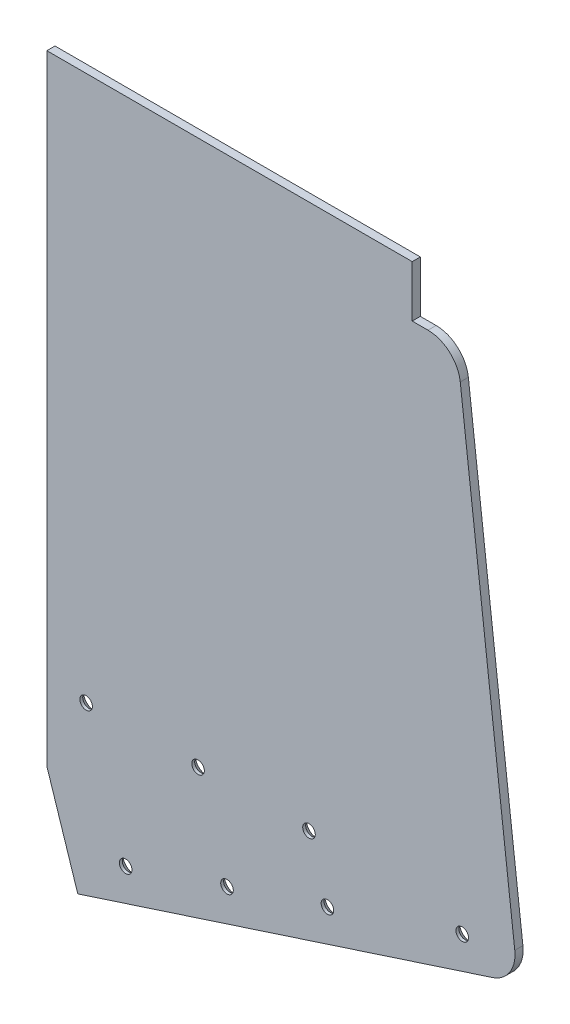
from build123d import *

# Parameters (mm, degrees)
BOSS_EXTRUDE1_DEPTH                           = 3.175
FILLET1_R                                     = 12.7
CUT_EXTRUDE1_DEPTH                            = 359.207230955
CSK_FOR_8_FLAT_HEAD_MACHINE_SCREW1_AT_2_COUNT = 2
CSK_FOR_8_FLAT_HEAD_MACHINE_SCREW1_AT_2_PITCH = 41.643335968
CSK_FOR_8_FLAT_HEAD_MACHINE_SCREW1_AT_3_COUNT = 2
CSK_FOR_8_FLAT_HEAD_MACHINE_SCREW1_AT_3_PITCH = 55.434622241
CSK_FOR_8_FLAT_HEAD_MACHINE_SCREW1_AT_4_COUNT = 2
CSK_FOR_8_FLAT_HEAD_MACHINE_SCREW1_AT_4_PITCH = 50.008853946
CSK_FOR_8_FLAT_HEAD_MACHINE_SCREW1_AT_5_COUNT = 2
CSK_FOR_8_FLAT_HEAD_MACHINE_SCREW1_AT_5_PITCH = 82.918335968
CSK_FOR_8_FLAT_HEAD_MACHINE_SCREW1_AT_6_COUNT = 2
CSK_FOR_8_FLAT_HEAD_MACHINE_SCREW1_AT_6_PITCH = 86.127052655
CSK_FOR_8_FLAT_HEAD_MACHINE_SCREW1_AT_7_COUNT = 2
CSK_FOR_8_FLAT_HEAD_MACHINE_SCREW1_AT_7_PITCH = 138.300491667


with BuildPart() as part:
    # Sketch1 → Boss-Extrude1 (new body)
    with BuildSketch(Plane.XY):
        Polygon((-234.752967181, 12.7), (-91.997327393, 12.7), (-91.997327393, -7.416979032), (-74.533465131, -7.416979032), (-50.700252483, -210.6746006), (-234.752967181, -270.542758328), align=None)
    extrude(amount=BOSS_EXTRUDE1_DEPTH)

    # Fillet1
    fillet1_edges = [part.edges().sort_by_distance(p)[0] for p in [
        (-74.533465131, -7.416979032, 1.5875),
        (-50.700252483, -210.6746006, 1.5875),
    ]]
    fillet(fillet1_edges, radius=FILLET1_R)

    # Sketch2 → Cut-Extrude1 (cut, through all)
    with BuildSketch(Plane.XY.offset(3.175)):
        Polygon((-234.752967181, -270.542758328), (-222.67581909, -266.614337017), (-234.752967181, -229.485553098), align=None)
    extrude(amount=-CUT_EXTRUDE1_DEPTH, mode=Mode.SUBTRACT)

    # Sketch4 → CSK for #8 Flat Head Machine Screw1 (revolve, cut)
    with BuildSketch(Plane(origin=(-203.96982343, -247.917009556, 0), x_dir=(0, 1, 0), z_dir=(1, 0, 0))):
        Polygon((0, 0), (0, 3.175), (2.45745, 3.175), (2.45745, 2.02344051), (4.2164, 0), align=None)
    csk_for_8_flat_head_machine_screw1 = revolve(axis=Axis((-203.96982343, -247.917009556, -6.35), (0, 0, 1)), mode=Mode.SUBTRACT)

    # CSK for #8 Flat Head Machine Screw1 at 2: CSK for #8 Flat Head Machine Screw1 ×2
    with Locations(*[Vector(0.9509565425677294, 0.30932451268470523, 0) * (i * CSK_FOR_8_FLAT_HEAD_MACHINE_SCREW1_AT_2_PITCH) for i in range(1, CSK_FOR_8_FLAT_HEAD_MACHINE_SCREW1_AT_2_COUNT)]):
        add(csk_for_8_flat_head_machine_screw1, mode=Mode.SUBTRACT)

    # CSK for #8 Flat Head Machine Screw1 at 3: CSK for #8 Flat Head Machine Screw1 ×2
    with Locations(*[Vector(0.5102012076622674, 0.8600550724808057, 0) * (i * CSK_FOR_8_FLAT_HEAD_MACHINE_SCREW1_AT_3_PITCH) for i in range(1, CSK_FOR_8_FLAT_HEAD_MACHINE_SCREW1_AT_3_COUNT)]):
        add(csk_for_8_flat_head_machine_screw1, mode=Mode.SUBTRACT)

    # CSK for #8 Flat Head Machine Screw1 at 4: CSK for #8 Flat Head Machine Screw1 ×2
    with Locations(*[Vector(-0.3093245126849687, 0.9509565425676436, 0) * (i * CSK_FOR_8_FLAT_HEAD_MACHINE_SCREW1_AT_4_PITCH) for i in range(1, CSK_FOR_8_FLAT_HEAD_MACHINE_SCREW1_AT_4_COUNT)]):
        add(csk_for_8_flat_head_machine_screw1, mode=Mode.SUBTRACT)

    # CSK for #8 Flat Head Machine Screw1 at 5: CSK for #8 Flat Head Machine Screw1 ×2
    with Locations(*[Vector(0.9509565425676433, 0.30932451268496985, 0) * (i * CSK_FOR_8_FLAT_HEAD_MACHINE_SCREW1_AT_5_PITCH) for i in range(1, CSK_FOR_8_FLAT_HEAD_MACHINE_SCREW1_AT_5_COUNT)]):
        add(csk_for_8_flat_head_machine_screw1, mode=Mode.SUBTRACT)

    # CSK for #8 Flat Head Machine Screw1 at 6: CSK for #8 Flat Head Machine Screw1 ×2
    with Locations(*[Vector(0.8318826599155766, 0.5549515655728751, 0) * (i * CSK_FOR_8_FLAT_HEAD_MACHINE_SCREW1_AT_6_PITCH) for i in range(1, CSK_FOR_8_FLAT_HEAD_MACHINE_SCREW1_AT_6_COUNT)]):
        add(csk_for_8_flat_head_machine_screw1, mode=Mode.SUBTRACT)

    # CSK for #8 Flat Head Machine Screw1 at 7: CSK for #8 Flat Head Machine Screw1 ×2
    with Locations(*[Vector(0.9509565425676433, 0.3093245126849699, 0) * (i * CSK_FOR_8_FLAT_HEAD_MACHINE_SCREW1_AT_7_PITCH) for i in range(1, CSK_FOR_8_FLAT_HEAD_MACHINE_SCREW1_AT_7_COUNT)]):
        add(csk_for_8_flat_head_machine_screw1, mode=Mode.SUBTRACT)


solid = part.part
